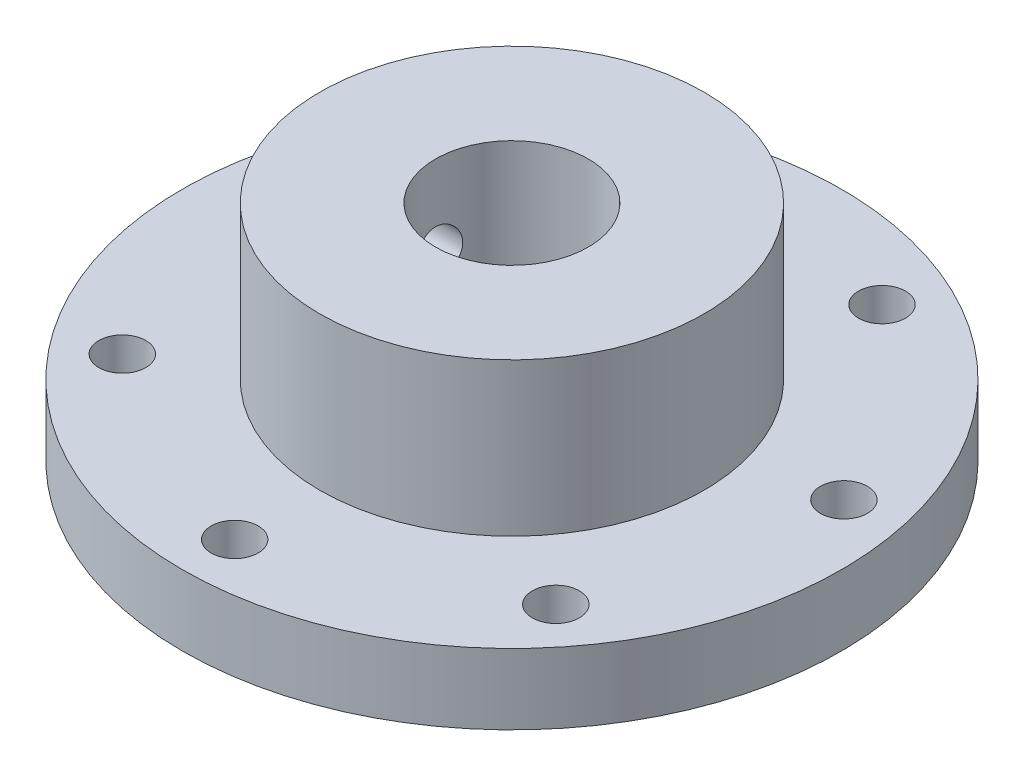
from build123d import *

# Parameters (mm, degrees)
BOSS_EXTRUDE1_DEPTH      = 6.5
BOSS_EXTRUDE1_DEPTH_BACK = 3
SKETCH1_R                = 8.175
SKETCH1_R_2              = 3.25
SKETCH1_3_R              = 14.023642089
SKETCH1_3_R_2            = 8.175
BOSS_EXTRUDE2_DEPTH      = 3
SKETCH2_R                = 1
CUT_EXTRUDE1_DEPTH       = 15
CUT_EXTRUDE2_DEPTH       = 3.175
CUT_EXTRUDE2_DEPTH_BACK  = 22.990340534
SKETCH3_R                = 1
SKETCH4_R                = 4.175
BOSS_EXTRUDE4_DEPTH      = 5
CUT_EXTRUDE3_DEPTH       = 15
CUT_EXTRUDE3_DEPTH_BACK  = 13
SKETCH1_5_R              = 3.25


with BuildPart() as part:
    # Sketch1 → Boss-Extrude1 (new, two sides: drawn at the far end of the back side and taken through both)
    with BuildSketch(Plane(origin=(0, 0, 0), x_dir=(1, 0, 0), z_dir=(0, 1, 0)).offset(-BOSS_EXTRUDE1_DEPTH_BACK)):
        Circle(SKETCH1_R)
        Circle(SKETCH1_R_2, mode=Mode.SUBTRACT)
    extrude(amount=BOSS_EXTRUDE1_DEPTH + BOSS_EXTRUDE1_DEPTH_BACK)

    # Sketch2 → Cut-Extrude1 (cut)
    with BuildSketch(Plane(origin=(0, 0, 0), x_dir=(0, 0, -1), z_dir=(1, 0, 0))):
        with Locations((0, 3)):
            Circle(SKETCH2_R)
    extrude(amount=-CUT_EXTRUDE1_DEPTH, mode=Mode.SUBTRACT)



with BuildPart() as body_2:
    # Sketch1<3> → Boss-Extrude2 (new body)
    with BuildSketch(Plane(origin=(0, 0, 0), x_dir=(1, 0, 0), z_dir=(0, 1, 0))):
        Circle(SKETCH1_3_R)
        Circle(SKETCH1_3_R_2, mode=Mode.SUBTRACT)
    extrude(amount=-BOSS_EXTRUDE2_DEPTH)

    # Sketch3 → Cut-Extrude2 (cut, two sides: drawn at the far end of the back side and taken through both)
    with BuildSketch(Plane.XZ.offset(3).offset(-CUT_EXTRUDE2_DEPTH_BACK)):
        with Locations((0, 11.797323524)):
            Circle(SKETCH3_R)
        with Locations((9.22351894, 7.355510906)):
            Circle(SKETCH3_R)
        with Locations((11.501539993, -2.625151449)):
            Circle(SKETCH3_R)
        with Locations((5.118666842, -10.62902122)):
            Circle(SKETCH3_R)
        with Locations((-5.118666842, -10.62902122)):
            Circle(SKETCH3_R)
        with Locations((-11.501539993, -2.625151449)):
            Circle(SKETCH3_R)
        with Locations((-9.22351894, 7.355510906)):
            Circle(SKETCH3_R)
    extrude(amount=CUT_EXTRUDE2_DEPTH + CUT_EXTRUDE2_DEPTH_BACK, mode=Mode.SUBTRACT)


with BuildPart() as part_1:
    add(part.part)

    add(body_2.part)  # Boss-Extrude4 merges body 2
    # Sketch4 → Boss-Extrude4 (add)
    with BuildSketch(Plane.XZ.offset(3)):
        Circle(SKETCH4_R)
    extrude(amount=BOSS_EXTRUDE4_DEPTH)

    # Sketch1<5> → Cut-Extrude3 (cut, two sides: drawn at the far end of the back side and taken through both)
    with BuildSketch(Plane(origin=(0, 0, 0), x_dir=(1, 0, 0), z_dir=(0, 1, 0)).offset(-CUT_EXTRUDE3_DEPTH_BACK)):
        Circle(SKETCH1_5_R)
    extrude(amount=CUT_EXTRUDE3_DEPTH + CUT_EXTRUDE3_DEPTH_BACK, mode=Mode.SUBTRACT)


solid = part_1.part
